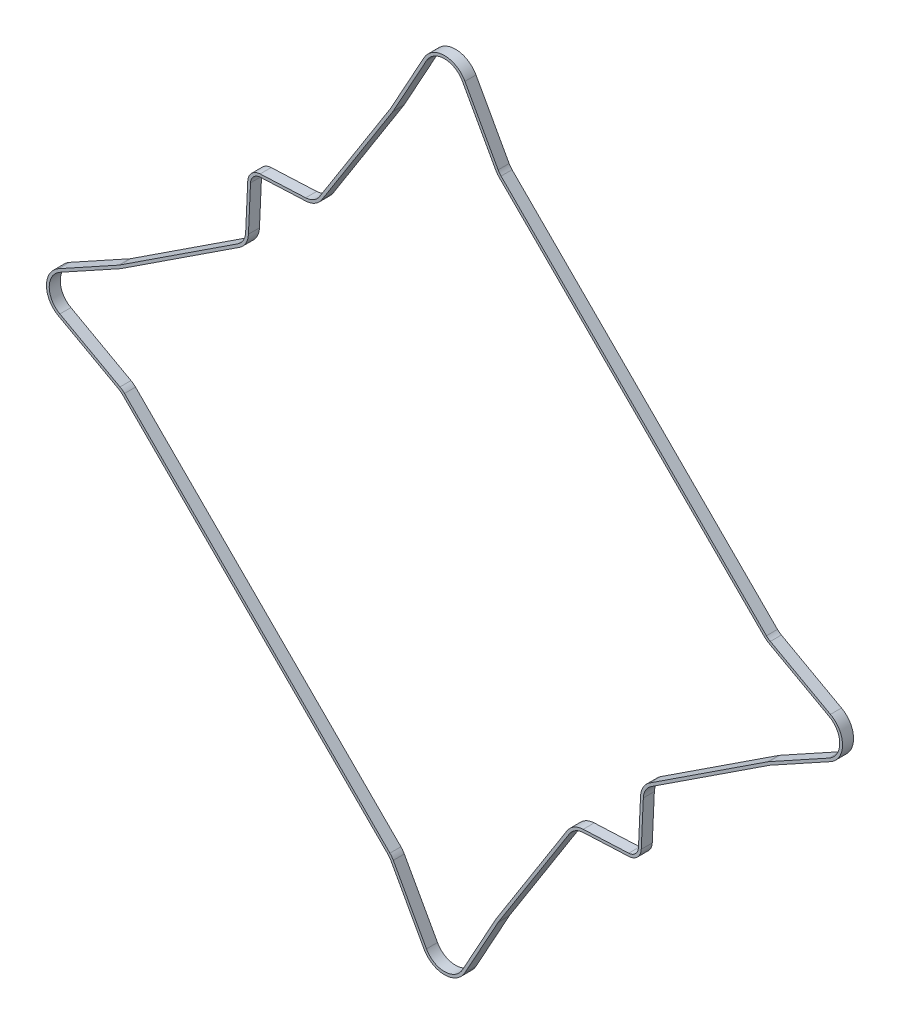
from build123d import *

# Parameters (mm, degrees)
EXTRUDE_THIN1_DEPTH = 3


with BuildPart() as part:
    # Sketch2 → Extrude-Thin1 (new, symmetric)
    with BuildSketch(Plane.XY):
        with BuildLine():
            Line((-30.511015203, -65.744573977), (8.003267358, -5.081152585))
            ThreePointArc((8.003267358, -5.081152585), (8.156222495, -4.831814836), (8.301412185, -4.577876771))
            Line((8.301412185, -4.577876771), (26.349049271, 28.149276433))
            ThreePointArc((26.349049271, 28.149276433), (37.5, 34.7341), (48.650950729, 28.149276433))
            Line((48.650950729, 28.149276433), (66.698587815, -4.577876771))
            ThreePointArc((66.698587815, -4.577876771), (67.422710112, -5.696935838), (68.296627714, -6.703372286))
            Line((68.296627714, -6.703372286), (212.796627714, -151.203372286))
            ThreePointArc((212.796627714, -151.203372286), (213.803064162, -152.077289888), (214.922123229, -152.801412185))
            Line((214.922123229, -152.801412185), (247.649276433, -170.849049271))
            ThreePointArc((247.649276433, -170.849049271), (254.2341, -182), (247.649276433, -193.150950729))
            Line((247.649276433, -193.150950729), (214.922123229, -211.198587815))
            ThreePointArc((214.922123229, -211.198587815), (214.609366132, -211.378910149), (214.303701601, -211.571009967))
            Line((214.303701601, -211.571009967), (150.037284252, -253.688288486))
            ThreePointArc((150.037284252, -253.688288486), (146.997960144, -256.922076508), (145.763452351, -261.184806444))
            Line((145.763452351, -261.184806444), (144.631039477, -285.982008601))
            ThreePointArc((144.631039477, -285.982008601), (142.563996899, -290.666992857), (137.879012644, -292.734035435))
            Line((137.879012644, -292.734035435), (113.081810486, -293.866448308))
            ThreePointArc((113.081810486, -293.866448308), (108.759684125, -295.135103515), (105.511015203, -298.255426023))
            Line((105.511015203, -298.255426023), (66.996732642, -358.918847415))
            ThreePointArc((66.996732642, -358.918847415), (66.843777505, -359.168185164), (66.698587814, -359.422123229))
            Line((66.698587815, -359.422123229), (48.650950729, -392.149276433))
            ThreePointArc((48.650950729, -392.149276433), (37.5, -398.7341), (26.349049271, -392.149276433))
            Line((26.349049271, -392.149276433), (8.301412185, -359.422123229))
            ThreePointArc((8.301412185, -359.422123229), (7.577289888, -358.303064162), (6.703372286, -357.296627714))
            Line((6.703372286, -357.296627714), (-137.796627714, -212.796627714))
            ThreePointArc((-137.796627714, -212.796627714), (-138.803064162, -211.922710112), (-139.922123229, -211.198587815))
            Line((-139.922123229, -211.198587815), (-172.649276433, -193.150950729))
            ThreePointArc((-172.649276433, -193.150950729), (-179.2341, -182), (-172.649276433, -170.849049271))
            Line((-172.649276433, -170.849049271), (-139.922123229, -152.801412185))
            ThreePointArc((-139.922123229, -152.801412185), (-139.609366132, -152.621089851), (-139.303701601, -152.428990033))
            Line((-139.303701601, -152.428990033), (-75.037284252, -110.311711514))
            ThreePointArc((-75.037284252, -110.311711514), (-71.997960144, -107.077923492), (-70.763452351, -102.815193556))
            Line((-70.763452351, -102.815193556), (-69.631039477, -78.017991399))
            ThreePointArc((-69.631039477, -78.017991399), (-67.563996899, -73.333007143), (-62.879012644, -71.265964565))
            Line((-62.879012644, -71.265964565), (-38.081810486, -70.133551692))
            ThreePointArc((-38.081810486, -70.133551692), (-33.759684125, -68.864896485), (-30.511015203, -65.744573977))
        make_face()
        with BuildLine():
            Line((-29.227790901, -66.559273547), (9.28649166, -5.895852156))
            ThreePointArc((9.28649166, -5.895852156), (9.46397125, -5.606536202), (9.6324403, -5.311882329))
            Line((9.6324403, -5.311882329), (27.680077385, 27.415270875))
            ThreePointArc((27.680077385, 27.415270875), (37.5, 33.2141), (47.319922615, 27.415270875))
            Line((47.319922615, 27.415270875), (65.3675597, -5.311882329))
            ThreePointArc((65.3675597, -5.311882329), (66.207785995, -6.610368589), (67.221825407, -7.778174593))
            Line((67.221825407, -7.778174593), (211.721825407, -152.278174593))
            ThreePointArc((211.721825407, -152.278174593), (212.889631411, -153.292214005), (214.188117671, -154.1324403))
            Line((214.188117671, -154.1324403), (246.915270875, -172.180077385))
            ThreePointArc((246.915270875, -172.180077385), (252.7141, -182), (246.915270875, -191.819922615))
            Line((246.915270875, -191.819922615), (214.188117671, -209.8675597))
            ThreePointArc((214.188117671, -209.8675597), (213.825213867, -210.076794476), (213.470539832, -210.299695109))
            Line((213.470539832, -210.299695109), (149.204122483, -252.416973628))
            ThreePointArc((149.204122483, -252.416973628), (145.677480586, -256.169259307), (144.245034834, -261.11546493))
            Line((144.245034834, -261.11546493), (143.112621961, -285.912667087))
            ThreePointArc((143.112621961, -285.912667087), (141.489194592, -289.592190549), (137.80967113, -291.215617918))
            Line((137.80967113, -291.215617918), (113.012468972, -292.348030792))
            ThreePointArc((113.012468972, -292.348030792), (107.997343447, -293.82009907), (104.227790901, -297.440726453))
            Line((104.227790901, -297.440726453), (65.71350834, -358.104147844))
            ThreePointArc((65.71350834, -358.104147844), (65.53602875, -358.393463798), (65.3675597, -358.688117671))
            Line((65.3675597, -358.688117671), (47.319922615, -391.415270875))
            ThreePointArc((47.319922615, -391.415270875), (37.5, -397.2141), (27.680077385, -391.415270875))
            Line((27.680077385, -391.415270875), (9.6324403, -358.688117671))
            ThreePointArc((9.6324403, -358.688117671), (8.792214005, -357.389631411), (7.778174593, -356.221825407))
            Line((7.778174593, -356.221825407), (-136.721825407, -211.721825407))
            ThreePointArc((-136.721825407, -211.721825407), (-137.889631411, -210.707785995), (-139.188117671, -209.8675597))
            Line((-139.188117671, -209.8675597), (-171.915270875, -191.819922615))
            ThreePointArc((-171.915270875, -191.819922615), (-177.7141, -182), (-171.915270875, -172.180077385))
            Line((-171.915270875, -172.180077385), (-139.188117671, -154.1324403))
            ThreePointArc((-139.188117671, -154.1324403), (-138.825213867, -153.923205524), (-138.470539832, -153.700304891))
            Line((-138.470539832, -153.700304891), (-74.204122483, -111.583026372))
            ThreePointArc((-74.204122483, -111.583026372), (-70.677480586, -107.830740693), (-69.245034834, -102.88453507))
            Line((-69.245034834, -102.88453507), (-68.112621961, -78.087332913))
            ThreePointArc((-68.112621961, -78.087332913), (-66.489194592, -74.407809451), (-62.80967113, -72.784382082))
            Line((-62.80967113, -72.784382082), (-38.012468972, -71.651969208))
            ThreePointArc((-38.012468972, -71.651969208), (-32.997343447, -70.17990093), (-29.227790901, -66.559273547))
        make_face(mode=Mode.SUBTRACT)
    extrude(amount=EXTRUDE_THIN1_DEPTH, both=True)


solid = part.part
